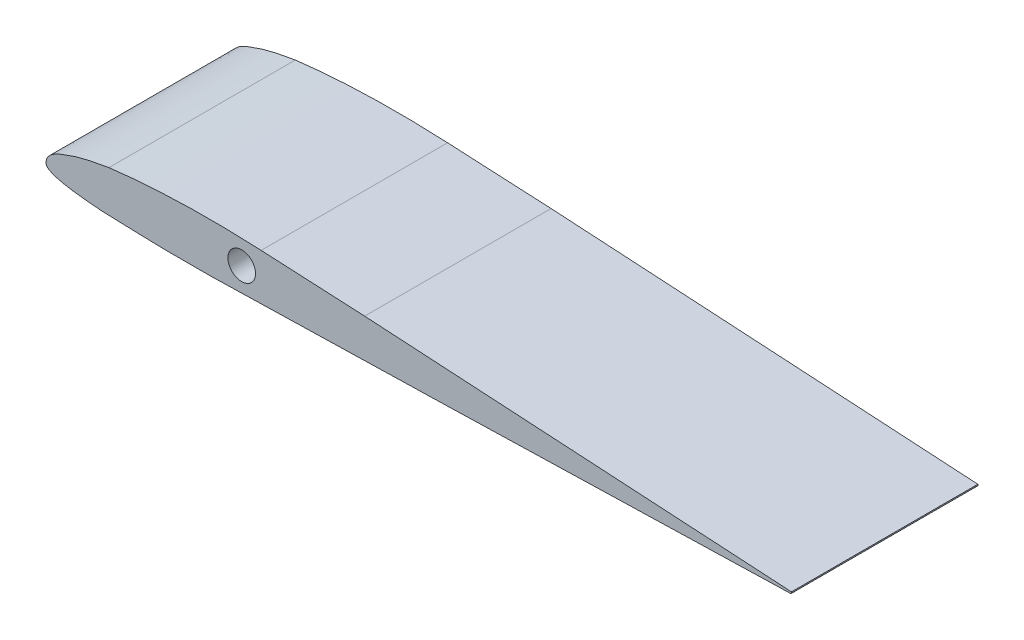
from build123d import *

# Parameters (mm, degrees)
AIRFOIL_DEPTH        = 50.8
CAMERA_CHANNEL_REACH = 212.213
SKETCH8_R            = 3.7592


with BuildPart() as part:
    # Sketch3 → Airfoil (new body)
    with BuildSketch(Plane.XY):
        with BuildLine():
            Line((202.994130812, 8.658655976), (110.583708873, 6.155294174))
            Line((110.583708873, 6.155294174), (45.243748526, 4.547671469))
            add(Edge.make_bspline(
                [(45.243748526, 4.547671469), (38.923572392, 4.568921268), (32.598685078, 4.437436548), (26.283676376, 4.693840567), (22.348358646, 4.853623607), (18.410196386, 4.937297779), (14.474878656, 5.097080819), (14.412947754, 5.099595357), (14.370093626, 5.173356562), (14.308475425, 5.180061537), (13.757234945, 5.240044692), (0.092319138, 5.933082267), (0.001596992, 8.740633601), (-0.083348667, 11.369421688), (3.240638559, 12.597933624), (5.152498304, 13.319770824), (6.702595853, 13.905021952), (8.281848193, 14.426252138), (9.890881707, 14.821641117), (12.262560893, 15.404435574), (14.691150833, 15.883501489), (17.149620686, 16.274957356)],
                knots=[0, 0, 0, 0, 1, 1, 1, 2, 2, 2, 3, 3, 3, 4, 4, 4, 5, 5, 5, 6, 6, 6, 6.272168289, 6.272168289, 6.272168289, 6.272168289], degree=3))
            add(Edge.make_bspline(
                [(17.149620686, 16.274957356), (28.832499255, 17.725653279), (42.670326445, 18.291936138), (58.641329464, 17.491030382)],
                knots=[0, 0, 0, 0, 1, 1, 1, 1], degree=3))
            Line((58.641329464, 17.491030382), (86.846468464, 16.076613382))
            Line((86.846468464, 16.076613382), (160.978559464, 11.666960382))
            Line((160.978559464, 11.666960382), (203.160688074, 9.157810196))
            ThreePointArc((203.160688074, 9.157810196), (203.180787666, 8.873737948), (202.994130812, 8.658655976))
        make_face()
    extrude(amount=AIRFOIL_DEPTH)

    # Sketch8 → Camera Channel (cut, up to next)
    with BuildSketch(Plane(origin=(0, 0, 0), x_dir=(-1, 0, 0), z_dir=(0, 0, -1)), mode=Mode.PRIVATE) as camera_channel_sk1:
        with Locations((-53.34, 11.228365492)):
            Circle(SKETCH8_R)
    camera_channel_tool1 = extrude(camera_channel_sk1.sketch, amount=-CAMERA_CHANNEL_REACH, mode=Mode.PRIVATE) & part.part
    add(camera_channel_tool1.solids().sort_by_distance((53.34, 11.228365, 0))[0], mode=Mode.SUBTRACT)


solid = part.part
